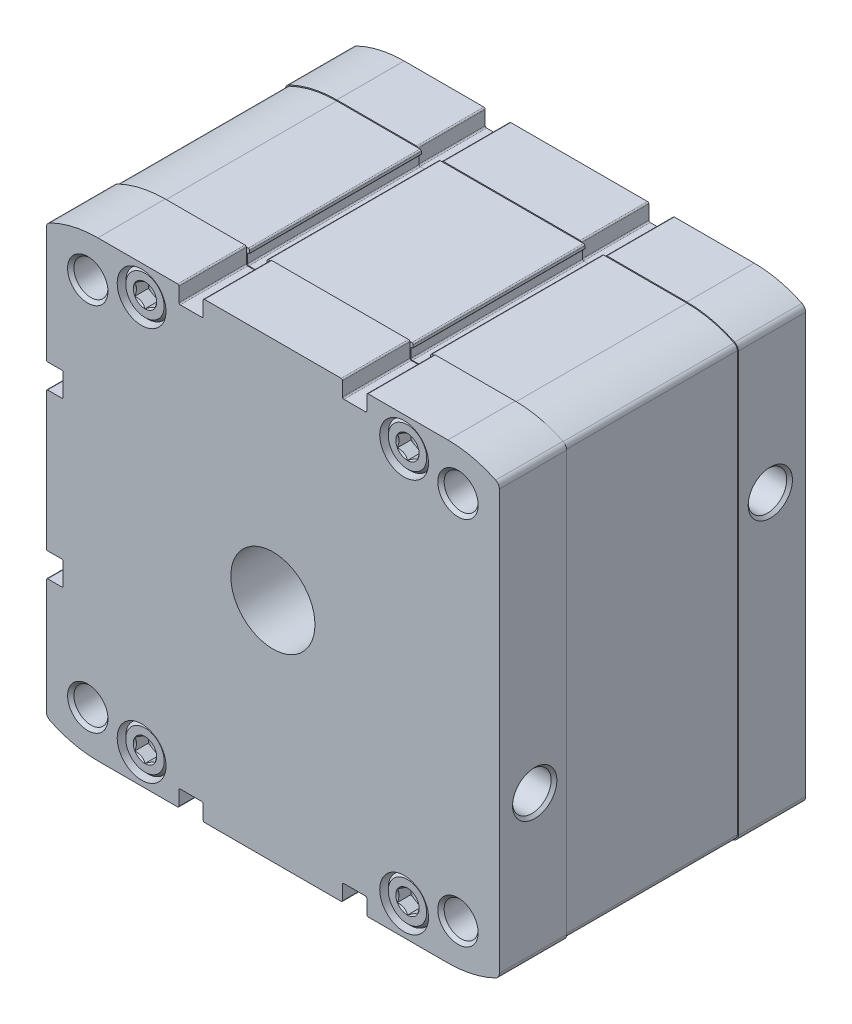
from build123d import *

# Parameters (mm, degrees)
BOSS_EXTRUDE1_DEPTH = 91
SKETCH2_W           = 134
SKETCH2_H           = 134
BOSS_EXTRUDE2_DEPTH = 51
SKETCH3_W           = 200
SKETCH3_H           = 200
CUT_EXTRUDE1_DEPTH  = 51
SKETCH7_W           = 2.6
SKETCH7_H           = 6
CUT_EXTRUDE2_DEPTH  = 4
CUT_EXTRUDE3_DEPTH  = 4
CUT_EXTRUDE4_DEPTH  = 4
CUT_EXTRUDE5_DEPTH  = 4
CUT_EXTRUDE6_DEPTH  = 4
CUT_EXTRUDE7_DEPTH  = 4
CUT_EXTRUDE8_DEPTH  = 4
CUT_EXTRUDE9_DEPTH  = 4
SKETCH29_W          = 51
SKETCH29_H          = 5.5
SKETCH31_W          = 51
SKETCH31_H          = 5.5
SKETCH33_W          = 51
SKETCH33_H          = 5.5
SKETCH35_W          = 51
SKETCH35_H          = 5.5


with BuildPart() as part:
    # Sketch1 → Boss-Extrude1 (new body)
    with BuildSketch(Plane.XY):
        with BuildLine():
            Line((-66.9, 27.9), (-62.7, 27.9))
            ThreePointArc((-62.7, 27.9), (-62.417157288, 27.782842712), (-62.3, 27.5))
            Line((-62.3, 27.5), (-62.3, 21.1))
            ThreePointArc((-62.3, 21.1), (-62.417157288, 20.817157288), (-62.7, 20.7))
            Line((-62.7, 20.7), (-66.9, 20.7))
            ThreePointArc((-66.9, 20.7), (-67.182842712, 20.582842712), (-67.3, 20.3))
            Line((-67.3, 20.3), (-67.3, -20.3))
            ThreePointArc((-67.3, -20.3), (-67.182842712, -20.582842712), (-66.9, -20.7))
            Line((-66.9, -20.7), (-62.7, -20.7))
            ThreePointArc((-62.7, -20.7), (-62.417157288, -20.817157288), (-62.3, -21.1))
            Line((-62.3, -21.1), (-62.3, -27.5))
            ThreePointArc((-62.3, -27.5), (-62.417157288, -27.782842712), (-62.7, -27.9))
            Line((-62.7, -27.9), (-66.9, -27.9))
            ThreePointArc((-66.9, -27.9), (-67.182842712, -28.017157288), (-67.3, -28.3))
            Line((-67.3, -28.3), (-67.3, -62.300902512))
            ThreePointArc((-67.3, -62.300902512), (-67.001263374, -63.338124412), (-66.196585366, -64.057545111))
            ThreePointArc((-66.196585366, -64.057545111), (-59.281080788, -66.479081896), (-52, -67.3))
            Line((-52, -67.3), (-28.3, -67.3))
            ThreePointArc((-28.3, -67.3), (-28.017157288, -67.182842712), (-27.9, -66.9))
            Line((-27.9, -66.9), (-27.9, -62.7))
            ThreePointArc((-27.9, -62.7), (-27.782842712, -62.417157288), (-27.5, -62.3))
            Line((-27.5, -62.3), (-21.1, -62.3))
            ThreePointArc((-21.1, -62.3), (-20.817157288, -62.417157288), (-20.7, -62.7))
            Line((-20.7, -62.7), (-20.7, -66.9))
            ThreePointArc((-20.7, -66.9), (-20.582842712, -67.182842712), (-20.3, -67.3))
            Line((-20.3, -67.3), (20.3, -67.3))
            ThreePointArc((20.3, -67.3), (20.582842712, -67.182842712), (20.7, -66.9))
            Line((20.7, -66.9), (20.7, -62.7))
            ThreePointArc((20.7, -62.7), (20.817157288, -62.417157288), (21.1, -62.3))
            Line((21.1, -62.3), (27.5, -62.3))
            ThreePointArc((27.5, -62.3), (27.782842712, -62.417157288), (27.9, -62.7))
            Line((27.9, -62.7), (27.9, -66.9))
            ThreePointArc((27.9, -66.9), (28.017157288, -67.182842712), (28.3, -67.3))
            Line((28.3, -67.3), (52, -67.3))
            ThreePointArc((52, -67.3), (59.281080788, -66.479081896), (66.196585366, -64.057545111))
            ThreePointArc((66.196585366, -64.057545111), (67.001263374, -63.338124412), (67.3, -62.300902512))
            Line((67.3, -62.300902512), (67.3, 62.300902512))
            ThreePointArc((67.3, 62.300902512), (67.001263374, 63.338124412), (66.196585366, 64.057545111))
            ThreePointArc((66.196585366, 64.057545111), (59.281080788, 66.479081896), (52, 67.3))
            Line((52, 67.3), (28.3, 67.3))
            ThreePointArc((28.3, 67.3), (28.017157288, 67.182842712), (27.9, 66.9))
            Line((27.9, 66.9), (27.9, 62.7))
            ThreePointArc((27.9, 62.7), (27.782842712, 62.417157288), (27.5, 62.3))
            Line((27.5, 62.3), (21.1, 62.3))
            ThreePointArc((21.1, 62.3), (20.817157288, 62.417157288), (20.7, 62.7))
            Line((20.7, 62.7), (20.7, 66.9))
            ThreePointArc((20.7, 66.9), (20.582842712, 67.182842712), (20.3, 67.3))
            Line((20.3, 67.3), (-20.3, 67.3))
            ThreePointArc((-20.3, 67.3), (-20.582842712, 67.182842712), (-20.7, 66.9))
            Line((-20.7, 66.9), (-20.7, 62.7))
            ThreePointArc((-20.7, 62.7), (-20.817157288, 62.417157288), (-21.1, 62.3))
            Line((-21.1, 62.3), (-27.5, 62.3))
            ThreePointArc((-27.5, 62.3), (-27.782842712, 62.417157288), (-27.9, 62.7))
            Line((-27.9, 62.7), (-27.9, 66.9))
            ThreePointArc((-27.9, 66.9), (-28.017157288, 67.182842712), (-28.3, 67.3))
            Line((-28.3, 67.3), (-52, 67.3))
            ThreePointArc((-52, 67.3), (-59.281080788, 66.479081896), (-66.196585366, 64.057545111))
            ThreePointArc((-66.196585366, 64.057545111), (-67.001263374, 63.338124412), (-67.3, 62.300902512))
            Line((-67.3, 62.300902512), (-67.3, 28.3))
            ThreePointArc((-67.3, 28.3), (-67.182842712, 28.017157288), (-66.9, 27.9))
        make_face()
    extrude(amount=-BOSS_EXTRUDE1_DEPTH)

    # Sketch2 → Boss-Extrude2 (add)
    with BuildSketch(Plane.XY.offset(-20)):
        Rectangle(SKETCH2_W, SKETCH2_H)
    extrude(amount=-BOSS_EXTRUDE2_DEPTH)

    # Sketch3 → Cut-Extrude1 (cut)
    with BuildSketch(Plane.XY.offset(-20)):
        Rectangle(SKETCH3_W, SKETCH3_H)
        with BuildLine():
            Line((-66.6, 26.9), (-65.9, 26.9))
            ThreePointArc((-65.9, 26.9), (-65.758578644, 26.958578644), (-65.7, 27.1))
            Line((-65.7, 27.1), (-65.7, 27.35))
            ThreePointArc((-65.7, 27.35), (-65.641421356, 27.491421356), (-65.5, 27.55))
            Line((-65.5, 27.55), (-62.9, 27.55))
            ThreePointArc((-62.9, 27.55), (-62.617157288, 27.432842712), (-62.5, 27.15))
            Line((-62.5, 27.15), (-62.5, 21.45))
            ThreePointArc((-62.5, 21.45), (-62.617157288, 21.167157288), (-62.9, 21.05))
            Line((-62.9, 21.05), (-65.5, 21.05))
            ThreePointArc((-65.5, 21.05), (-65.641421356, 21.108578644), (-65.7, 21.25))
            Line((-65.7, 21.25), (-65.7, 21.5))
            ThreePointArc((-65.7, 21.5), (-65.758578644, 21.641421356), (-65.9, 21.7))
            Line((-65.9, 21.7), (-66.6, 21.7))
            ThreePointArc((-66.6, 21.7), (-66.882842712, 21.582842712), (-67, 21.3))
            Line((-67, 21.3), (-67, -21.3))
            ThreePointArc((-67, -21.3), (-66.882842712, -21.582842712), (-66.6, -21.7))
            Line((-66.6, -21.7), (-65.9, -21.7))
            ThreePointArc((-65.9, -21.7), (-65.758578644, -21.641421356), (-65.7, -21.5))
            Line((-65.7, -21.5), (-65.7, -21.25))
            ThreePointArc((-65.7, -21.25), (-65.641421356, -21.108578644), (-65.5, -21.05))
            Line((-65.5, -21.05), (-62.9, -21.05))
            ThreePointArc((-62.9, -21.05), (-62.617157288, -21.167157288), (-62.5, -21.45))
            Line((-62.5, -21.45), (-62.5, -27.15))
            ThreePointArc((-62.5, -27.15), (-62.617157288, -27.432842712), (-62.9, -27.55))
            Line((-62.9, -27.55), (-65.5, -27.55))
            ThreePointArc((-65.5, -27.55), (-65.641421356, -27.491421356), (-65.7, -27.35))
            Line((-65.7, -27.35), (-65.7, -27.1))
            ThreePointArc((-65.7, -27.1), (-65.758578644, -26.958578644), (-65.9, -26.9))
            Line((-65.9, -26.9), (-66.6, -26.9))
            ThreePointArc((-66.6, -26.9), (-66.882842712, -27.017157288), (-67, -27.3))
            Line((-67, -27.3), (-67, -62.269477769))
            ThreePointArc((-67, -62.269477769), (-66.739100334, -63.174458558), (-66.036482085, -63.801663834))
            ThreePointArc((-66.036482085, -63.801663834), (-59.198127943, -66.190298418), (-52, -67))
            Line((-52, -67), (-27.3, -67))
            ThreePointArc((-27.3, -67), (-27.017157288, -66.882842712), (-26.9, -66.6))
            Line((-26.9, -66.6), (-26.9, -65.9))
            ThreePointArc((-26.9, -65.9), (-26.958578644, -65.758578644), (-27.1, -65.7))
            Line((-27.1, -65.7), (-27.35, -65.7))
            ThreePointArc((-27.35, -65.7), (-27.491421356, -65.641421356), (-27.55, -65.5))
            Line((-27.55, -65.5), (-27.55, -62.9))
            ThreePointArc((-27.55, -62.9), (-27.432842712, -62.617157288), (-27.15, -62.5))
            Line((-27.15, -62.5), (-21.45, -62.5))
            ThreePointArc((-21.45, -62.5), (-21.167157288, -62.617157288), (-21.05, -62.9))
            Line((-21.05, -62.9), (-21.05, -65.5))
            ThreePointArc((-21.05, -65.5), (-21.108578644, -65.641421356), (-21.25, -65.7))
            Line((-21.25, -65.7), (-21.5, -65.7))
            ThreePointArc((-21.5, -65.7), (-21.641421356, -65.758578644), (-21.7, -65.9))
            Line((-21.7, -65.9), (-21.7, -66.6))
            ThreePointArc((-21.7, -66.6), (-21.582842712, -66.882842712), (-21.3, -67))
            Line((-21.3, -67), (21.3, -67))
            ThreePointArc((21.3, -67), (21.582842712, -66.882842712), (21.7, -66.6))
            Line((21.7, -66.6), (21.7, -65.9))
            ThreePointArc((21.7, -65.9), (21.641421356, -65.758578644), (21.5, -65.7))
            Line((21.5, -65.7), (21.25, -65.7))
            ThreePointArc((21.25, -65.7), (21.108578644, -65.641421356), (21.05, -65.5))
            Line((21.05, -65.5), (21.05, -62.9))
            ThreePointArc((21.05, -62.9), (21.167157288, -62.617157288), (21.45, -62.5))
            Line((21.45, -62.5), (27.15, -62.5))
            ThreePointArc((27.15, -62.5), (27.432842712, -62.617157288), (27.55, -62.9))
            Line((27.55, -62.9), (27.55, -65.5))
            ThreePointArc((27.55, -65.5), (27.491421356, -65.641421356), (27.35, -65.7))
            Line((27.35, -65.7), (27.1, -65.7))
            ThreePointArc((27.1, -65.7), (26.958578644, -65.758578644), (26.9, -65.9))
            Line((26.9, -65.9), (26.9, -66.6))
            ThreePointArc((26.9, -66.6), (27.017157288, -66.882842712), (27.3, -67))
            Line((27.3, -67), (52, -67))
            ThreePointArc((52, -67), (59.198127943, -66.190298418), (66.036482085, -63.801663834))
            ThreePointArc((66.036482085, -63.801663834), (66.739100334, -63.174458558), (67, -62.269477769))
            Line((67, -62.269477769), (67, 62.269477769))
            ThreePointArc((67, 62.269477769), (66.739100334, 63.174458558), (66.036482085, 63.801663834))
            ThreePointArc((66.036482085, 63.801663834), (59.198127943, 66.190298418), (52, 67))
            Line((52, 67), (27.3, 67))
            ThreePointArc((27.3, 67), (27.017157288, 66.882842712), (26.9, 66.6))
            Line((26.9, 66.6), (26.9, 65.9))
            ThreePointArc((26.9, 65.9), (26.958578644, 65.758578644), (27.1, 65.7))
            Line((27.1, 65.7), (27.35, 65.7))
            ThreePointArc((27.35, 65.7), (27.491421356, 65.641421356), (27.55, 65.5))
            Line((27.55, 65.5), (27.55, 62.9))
            ThreePointArc((27.55, 62.9), (27.432842712, 62.617157288), (27.15, 62.5))
            Line((27.15, 62.5), (21.45, 62.5))
            ThreePointArc((21.45, 62.5), (21.167157288, 62.617157288), (21.05, 62.9))
            Line((21.05, 62.9), (21.05, 65.5))
            ThreePointArc((21.05, 65.5), (21.108578644, 65.641421356), (21.25, 65.7))
            Line((21.25, 65.7), (21.5, 65.7))
            ThreePointArc((21.5, 65.7), (21.641421356, 65.758578644), (21.7, 65.9))
            Line((21.7, 65.9), (21.7, 66.6))
            ThreePointArc((21.7, 66.6), (21.582842712, 66.882842712), (21.3, 67))
            Line((21.3, 67), (-21.3, 67))
            ThreePointArc((-21.3, 67), (-21.582842712, 66.882842712), (-21.7, 66.6))
            Line((-21.7, 66.6), (-21.7, 65.9))
            ThreePointArc((-21.7, 65.9), (-21.641421356, 65.758578644), (-21.5, 65.7))
            Line((-21.5, 65.7), (-21.25, 65.7))
            ThreePointArc((-21.25, 65.7), (-21.108578644, 65.641421356), (-21.05, 65.5))
            Line((-21.05, 65.5), (-21.05, 62.9))
            ThreePointArc((-21.05, 62.9), (-21.167157288, 62.617157288), (-21.45, 62.5))
            Line((-21.45, 62.5), (-27.15, 62.5))
            ThreePointArc((-27.15, 62.5), (-27.432842712, 62.617157288), (-27.55, 62.9))
            Line((-27.55, 62.9), (-27.55, 65.5))
            ThreePointArc((-27.55, 65.5), (-27.491421356, 65.641421356), (-27.35, 65.7))
            Line((-27.35, 65.7), (-27.1, 65.7))
            ThreePointArc((-27.1, 65.7), (-26.958578644, 65.758578644), (-26.9, 65.9))
            Line((-26.9, 65.9), (-26.9, 66.6))
            ThreePointArc((-26.9, 66.6), (-27.017157288, 66.882842712), (-27.3, 67))
            Line((-27.3, 67), (-52, 67))
            ThreePointArc((-52, 67), (-59.198127943, 66.190298418), (-66.036482085, 63.801663834))
            ThreePointArc((-66.036482085, 63.801663834), (-66.739100334, 63.174458558), (-67, 62.269477769))
            Line((-67, 62.269477769), (-67, 27.3))
            ThreePointArc((-67, 27.3), (-66.882842712, 27.017157288), (-66.6, 26.9))
        make_face(mode=Mode.SUBTRACT)
    extrude(amount=-CUT_EXTRUDE1_DEPTH, mode=Mode.SUBTRACT)

    # Sketch4 → Cut-Revolve1 (revolve, cut)
    with BuildSketch(Plane(origin=(0, -21.15, 0), x_dir=(1, 0, 0), z_dir=(0, 1, 0))):
        Polygon((39.5, 10.5), (39.5, 16.2225), (66.444, 16.2225), (67.3, 17.0785), (67.3, 10.5), align=None)
    revolve(axis=Axis((67.3, -21.15, -10.5), (-1, 0, 0)), mode=Mode.SUBTRACT)

    # Sketch5 → Cut-Revolve2 (revolve, cut)
    with BuildSketch(Plane(origin=(0, 21.15, 0), x_dir=(1, 0, 0), z_dir=(0, 1, 0))):
        Polygon((39.5, 80.5), (39.5, 86.2225), (66.444, 86.2225), (67.3, 87.0785), (67.3, 80.5), align=None)
    revolve(axis=Axis((67.3, 21.15, -80.5), (-1, 0, 0)), mode=Mode.SUBTRACT)

    # Sketch6 → Cut-Revolve3 (revolve, cut)
    with BuildSketch(Plane(origin=(0, 0, 0), x_dir=(0, 0, -1), z_dir=(1, 0, 0))):
        Polygon((-1, 0), (-1, 12.5), (28.75, 12.5), (28.75, 62.5), (70, 62.5), (70, 0), align=None)
    revolve(axis=Axis((0, 0, -70), (0, 0, 1)), mode=Mode.SUBTRACT)

    # Sketch7 → Cut-Revolve4 (revolve, cut)
    with BuildSketch(Plane(origin=(0, 0, 0), x_dir=(0, 0, -1), z_dir=(1, 0, 0))):
        with Locations((89.7, 3)):
            Rectangle(SKETCH7_W, SKETCH7_H)
    revolve(axis=Axis((0, 0, -91), (0, 0, 1)), mode=Mode.SUBTRACT)

    # Sketch8 → Cut-Revolve5 (revolve, cut)
    with BuildSketch(Plane(origin=(0, 58.5, 0), x_dir=(1, 0, 0), z_dir=(0, 1, 0))):
        Polygon((39, 5.803847577), (42, 5), (42, 1.48), (42.48, 1), (44.7, 1), (45.5, 1.8), (45.5, 9), (46.25, 9), (46.25, -1), (39, -1), align=None)
    revolve(axis=Axis((39, 58.5, 1), (0, 0, -1)), mode=Mode.SUBTRACT)

    # Sketch9 → Cut-Revolve6 (revolve, cut)
    with BuildSketch(Plane(origin=(0, 58.5, 0), x_dir=(1, 0, 0), z_dir=(0, 1, 0))):
        Polygon((-39, 5.803847577), (-36, 5), (-36, 1.48), (-35.52, 1), (-33.3, 1), (-32.5, 1.8), (-32.5, 9), (-31.75, 9), (-31.75, -1), (-39, -1), align=None)
    revolve(axis=Axis((-39, 58.5, 1), (0, 0, -1)), mode=Mode.SUBTRACT)

    # Sketch10 → Cut-Revolve7 (revolve, cut)
    with BuildSketch(Plane(origin=(0, -58.5, 0), x_dir=(1, 0, 0), z_dir=(0, 1, 0))):
        Polygon((39, 5.803847577), (42, 5), (42, 1.48), (42.48, 1), (44.7, 1), (45.5, 1.8), (45.5, 9), (46.25, 9), (46.25, -1), (39, -1), align=None)
    revolve(axis=Axis((39, -58.5, 1), (0, 0, -1)), mode=Mode.SUBTRACT)

    # Sketch11 → Cut-Revolve8 (revolve, cut)
    with BuildSketch(Plane(origin=(0, -58.5, 0), x_dir=(1, 0, 0), z_dir=(0, 1, 0))):
        Polygon((-39, 5.803847577), (-36, 5), (-36, 1.48), (-35.52, 1), (-33.3, 1), (-32.5, 1.8), (-32.5, 9), (-31.75, 9), (-31.75, -1), (-39, -1), align=None)
    revolve(axis=Axis((-39, -58.5, 1), (0, 0, -1)), mode=Mode.SUBTRACT)

    # Sketch12 → Cut-Revolve9 (revolve, cut)
    with BuildSketch(Plane(origin=(0, 58.5, 0), x_dir=(1, 0, 0), z_dir=(0, 1, 0))):
        Polygon((39, 92), (46.25, 92), (46.25, 82), (45.5, 82), (45.5, 89.2), (44.7, 90), (42.48, 90), (42, 89.52), (42, 86), (39, 85.196152423), align=None)
    revolve(axis=Axis((39, 58.5, -85.196152423), (0, 0, -1)), mode=Mode.SUBTRACT)

    # Sketch13 → Cut-Revolve10 (revolve, cut)
    with BuildSketch(Plane(origin=(0, 58.5, 0), x_dir=(1, 0, 0), z_dir=(0, 1, 0))):
        Polygon((-39, 92), (-31.75, 92), (-31.75, 82), (-32.5, 82), (-32.5, 89.2), (-33.3, 90), (-35.52, 90), (-36, 89.52), (-36, 86), (-39, 85.196152423), align=None)
    revolve(axis=Axis((-39, 58.5, -85.196152423), (0, 0, -1)), mode=Mode.SUBTRACT)

    # Sketch14 → Cut-Revolve11 (revolve, cut)
    with BuildSketch(Plane(origin=(0, -58.5, 0), x_dir=(1, 0, 0), z_dir=(0, 1, 0))):
        Polygon((-39, 92), (-31.75, 92), (-31.75, 82), (-32.5, 82), (-32.5, 89.2), (-33.3, 90), (-35.52, 90), (-36, 89.52), (-36, 86), (-39, 85.196152423), align=None)
    revolve(axis=Axis((-39, -58.5, -85.196152423), (0, 0, -1)), mode=Mode.SUBTRACT)

    # Sketch15 → Cut-Revolve12 (revolve, cut)
    with BuildSketch(Plane(origin=(0, -58.5, 0), x_dir=(1, 0, 0), z_dir=(0, 1, 0))):
        Polygon((39, 92), (46.25, 92), (46.25, 82), (45.5, 82), (45.5, 89.2), (44.7, 90), (42.48, 90), (42, 89.52), (42, 86), (39, 85.196152423), align=None)
    revolve(axis=Axis((39, -58.5, -85.196152423), (0, 0, -1)), mode=Mode.SUBTRACT)

    # Sketch16 → Cut-Extrude2 (cut)
    with BuildSketch(Plane.XY.offset(-1)):
        Polygon((36, 56.767949192), (39, 55.035898385), (42, 56.767949192), (42, 60.232050808), (39, 61.964101615), (36, 60.232050808), align=None)
    extrude(amount=-CUT_EXTRUDE2_DEPTH, mode=Mode.SUBTRACT)

    # Sketch17 → Cut-Extrude3 (cut)
    with BuildSketch(Plane.XY.offset(-1)):
        Polygon((-42, 56.767949192), (-39, 55.035898385), (-36, 56.767949192), (-36, 60.232050808), (-39, 61.964101615), (-42, 60.232050808), align=None)
    extrude(amount=-CUT_EXTRUDE3_DEPTH, mode=Mode.SUBTRACT)

    # Sketch18 → Cut-Extrude4 (cut)
    with BuildSketch(Plane.XY.offset(-1)):
        Polygon((-42, -60.232050808), (-39, -61.964101615), (-36, -60.232050808), (-36, -56.767949192), (-39, -55.035898385), (-42, -56.767949192), align=None)
    extrude(amount=-CUT_EXTRUDE4_DEPTH, mode=Mode.SUBTRACT)

    # Sketch19 → Cut-Extrude5 (cut)
    with BuildSketch(Plane.XY.offset(-1)):
        Polygon((36, -60.232050808), (39, -61.964101615), (42, -60.232050808), (42, -56.767949192), (39, -55.035898385), (36, -56.767949192), align=None)
    extrude(amount=-CUT_EXTRUDE5_DEPTH, mode=Mode.SUBTRACT)

    # Sketch20 → Cut-Extrude6 (cut)
    with BuildSketch(Plane.XY.offset(-90)):
        Polygon((36, 56.767949192), (39, 55.035898385), (42, 56.767949192), (42, 60.232050808), (39, 61.964101615), (36, 60.232050808), align=None)
    extrude(amount=CUT_EXTRUDE6_DEPTH, mode=Mode.SUBTRACT)

    # Sketch21 → Cut-Extrude7 (cut)
    with BuildSketch(Plane.XY.offset(-90)):
        Polygon((-42, 56.767949192), (-39, 55.035898385), (-36, 56.767949192), (-36, 60.232050808), (-39, 61.964101615), (-42, 60.232050808), align=None)
    extrude(amount=CUT_EXTRUDE7_DEPTH, mode=Mode.SUBTRACT)

    # Sketch22 → Cut-Extrude8 (cut)
    with BuildSketch(Plane.XY.offset(-90)):
        Polygon((-42, -60.232050808), (-39, -61.964101615), (-36, -60.232050808), (-36, -56.767949192), (-39, -55.035898385), (-42, -56.767949192), align=None)
    extrude(amount=CUT_EXTRUDE8_DEPTH, mode=Mode.SUBTRACT)

    # Sketch23 → Cut-Extrude9 (cut)
    with BuildSketch(Plane.XY.offset(-90)):
        Polygon((36, -60.232050808), (39, -61.964101615), (42, -60.232050808), (42, -56.767949192), (39, -55.035898385), (36, -56.767949192), align=None)
    extrude(amount=CUT_EXTRUDE9_DEPTH, mode=Mode.SUBTRACT)

    # Sketch24 → Cut-Revolve13 (revolve, cut)
    with BuildSketch(Plane(origin=(55, 0, 0), x_dir=(0, 0, -1), z_dir=(1, 0, 0))):
        Polygon((0, 55), (0, 61), (0.947, 60.053), (20, 60.053), (20, 55), align=None)
    revolve(axis=Axis((55, 55, -20), (0, 0, 1)), mode=Mode.SUBTRACT)

    # Sketch25 → Cut-Revolve14 (revolve, cut)
    with BuildSketch(Plane(origin=(-55, 0, 0), x_dir=(0, 0, -1), z_dir=(1, 0, 0))):
        Polygon((0, 55), (0, 61), (0.947, 60.053), (20, 60.053), (20, 55), align=None)
    revolve(axis=Axis((-55, 55, -20), (0, 0, 1)), mode=Mode.SUBTRACT)

    # Sketch26 → Cut-Revolve15 (revolve, cut)
    with BuildSketch(Plane(origin=(55, 0, 0), x_dir=(0, 0, -1), z_dir=(1, 0, 0))):
        Polygon((0, -55), (0, -49), (0.947, -49.947), (20, -49.947), (20, -55), align=None)
    revolve(axis=Axis((55, -55, -20), (0, 0, 1)), mode=Mode.SUBTRACT)

    # Sketch27 → Cut-Revolve16 (revolve, cut)
    with BuildSketch(Plane(origin=(-55, 0, 0), x_dir=(0, 0, -1), z_dir=(1, 0, 0))):
        Polygon((0, -55), (0, -49), (0.947, -49.947), (20, -49.947), (20, -55), align=None)
    revolve(axis=Axis((-55, -55, -20), (0, 0, 1)), mode=Mode.SUBTRACT)

    # Sketch28 → Cut-Revolve17 (revolve, cut)
    with BuildSketch(Plane(origin=(55, 0, 0), x_dir=(0, 0, -1), z_dir=(1, 0, 0))):
        Polygon((71, 55), (71, 60.053), (90.053, 60.053), (91, 61), (91, 55), align=None)
    revolve(axis=Axis((55, 55, -91), (0, 0, 1)), mode=Mode.SUBTRACT)

    # Sketch29 → Cut-Revolve18 (revolve, cut)
    with BuildSketch(Plane(origin=(55, 0, 0), x_dir=(0, 0, -1), z_dir=(1, 0, 0))):
        with Locations((45.5, 57.75)):
            Rectangle(SKETCH29_W, SKETCH29_H)
    revolve(axis=Axis((55, 55, -71), (0, 0, 1)), mode=Mode.SUBTRACT)

    # Sketch30 → Cut-Revolve19 (revolve, cut)
    with BuildSketch(Plane(origin=(-55, 0, 0), x_dir=(0, 0, -1), z_dir=(1, 0, 0))):
        Polygon((71, 55), (71, 60.053), (90.053, 60.053), (91, 61), (91, 55), align=None)
    revolve(axis=Axis((-55, 55, -91), (0, 0, 1)), mode=Mode.SUBTRACT)

    # Sketch31 → Cut-Revolve20 (revolve, cut)
    with BuildSketch(Plane(origin=(-55, 0, 0), x_dir=(0, 0, -1), z_dir=(1, 0, 0))):
        with Locations((45.5, 57.75)):
            Rectangle(SKETCH31_W, SKETCH31_H)
    revolve(axis=Axis((-55, 55, -71), (0, 0, 1)), mode=Mode.SUBTRACT)

    # Sketch32 → Cut-Revolve21 (revolve, cut)
    with BuildSketch(Plane(origin=(55, 0, 0), x_dir=(0, 0, -1), z_dir=(1, 0, 0))):
        Polygon((71, -55), (71, -49.947), (90.053, -49.947), (91, -49), (91, -55), align=None)
    revolve(axis=Axis((55, -55, -91), (0, 0, 1)), mode=Mode.SUBTRACT)

    # Sketch33 → Cut-Revolve22 (revolve, cut)
    with BuildSketch(Plane(origin=(55, 0, 0), x_dir=(0, 0, -1), z_dir=(1, 0, 0))):
        with Locations((45.5, -52.25)):
            Rectangle(SKETCH33_W, SKETCH33_H)
    revolve(axis=Axis((55, -55, -71), (0, 0, 1)), mode=Mode.SUBTRACT)

    # Sketch34 → Cut-Revolve23 (revolve, cut)
    with BuildSketch(Plane(origin=(-55, 0, 0), x_dir=(0, 0, -1), z_dir=(1, 0, 0))):
        Polygon((71, -55), (71, -49.947), (90.053, -49.947), (91, -49), (91, -55), align=None)
    revolve(axis=Axis((-55, -55, -91), (0, 0, 1)), mode=Mode.SUBTRACT)

    # Sketch35 → Cut-Revolve24 (revolve, cut)
    with BuildSketch(Plane(origin=(-55, 0, 0), x_dir=(0, 0, -1), z_dir=(1, 0, 0))):
        with Locations((45.5, -52.25)):
            Rectangle(SKETCH35_W, SKETCH35_H)
    revolve(axis=Axis((-55, -55, -71), (0, 0, 1)), mode=Mode.SUBTRACT)


solid = part.part
